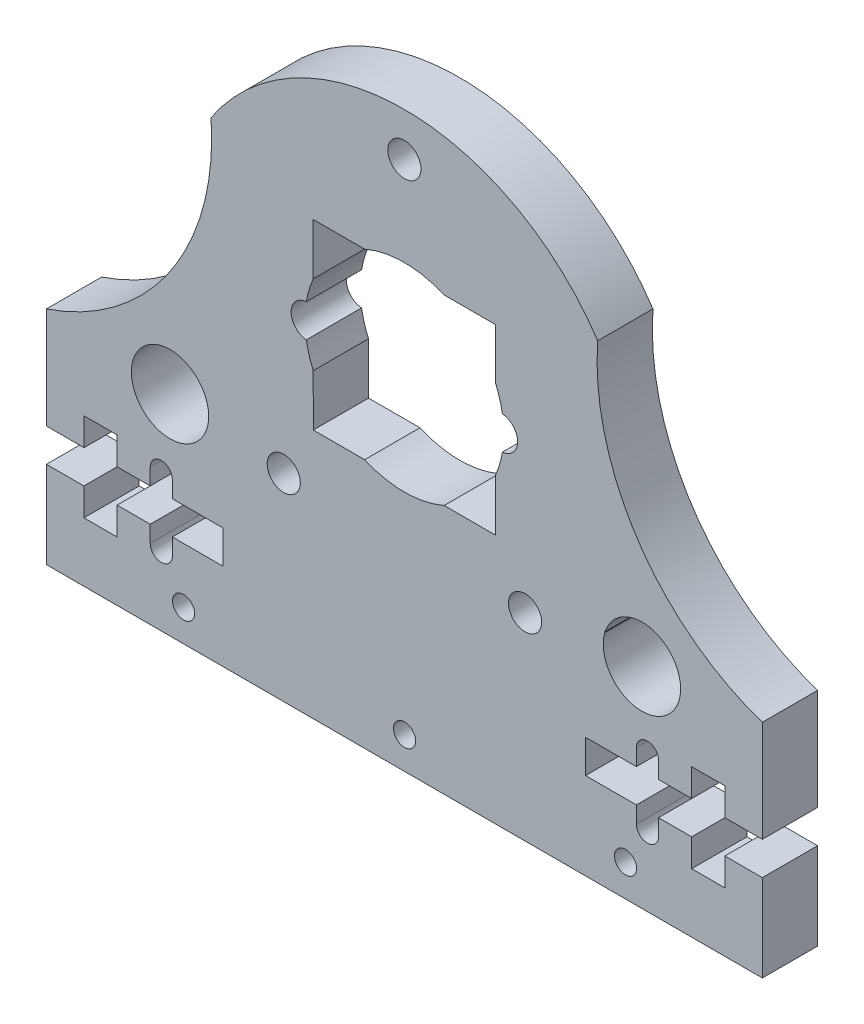
from build123d import *

# Parameters (mm, degrees)
SKETCH1_R           = 3.5
SKETCH1_R_2         = 1.5
BOSS_EXTRUDE1_DEPTH = 5
SKETCH2_W           = 3
SKETCH2_H           = 8
SKETCH2_W_2         = 16
SKETCH2_H_2         = 3
CUT_EXTRUDE3_DEPTH  = 10
SKETCH4_OUTSIDE_W   = 83.878
SKETCH4_OUTSIDE_H   = 74.539
CUT_EXTRUDE5_DEPTH  = 10
BOSS_EXTRUDE2_DEPTH = 5
SKETCH5_R           = 1
CUT_EXTRUDE6_DEPTH  = 5
CUT_EXTRUDE7_DEPTH  = 46.035343011


with BuildPart() as part:
    # Sketch1 → Boss-Extrude1 (new body)
    with BuildSketch(Plane.XY):
        with BuildLine():
            Line((16.678684739, -6.865443356), (7.048954955, 19.63254949))
            ThreePointArc((7.048954955, 19.63254949), (-0.000574134, 24.570863688), (-7.049347073, 19.631470247))
            Line((-7.049347073, 19.631470247), (-16.60248251, -6.668301445))
            ThreePointArc((-16.60248251, -6.668301445), (-23.589225287, -5.352701736), (-28.111762071, -10.838322782))
            Line((-28.111762071, -10.838322782), (-32.396038203, -10.838322782))
            Line((-32.396038203, -10.838322782), (-32.396038203, -30.881690835))
            Line((-32.396038203, -30.881690835), (32.396038203, -30.881690835))
            Line((32.396038203, -30.881690835), (32.396038203, -10.838322782))
            Line((32.396038203, -10.838322782), (28.403544795, -10.838322782))
            ThreePointArc((28.403544795, -10.838322782), (23.74315896, -5.304380506), (16.678684739, -6.865443356))
        make_face()
        with Locations((-21.209007359, -11.922115015)):
            Circle(SKETCH1_R, mode=Mode.SUBTRACT)
        with BuildLine():
            Line((3.592595297, 8.251863973), (8.245757774, 8.254276772))
            Line((8.245757774, 8.254276772), (8.248133809, 3.67201473))
            ThreePointArc((8.248133809, 3.67201473), (8.625435504, 2.640272663), (8.874223719, 1.570248043))
            ThreePointArc((8.874223719, 1.570248043), (10.249998622, 0.076178628), (8.875773895, -1.41931674))
            ThreePointArc((8.875773895, -1.41931674), (8.62809549, -2.489598792), (8.251863973, -3.521731588))
            Line((8.251863973, -3.521731588), (8.254313497, -8.24572101))
            Line((8.254313497, -8.24572101), (3.601151021, -8.248133809))
            ThreePointArc((3.601151021, -8.248133809), (0.004666758, -8.99999879), (-3.592595297, -8.251863973))
            Line((-3.592595297, -8.251863973), (-8.245721029, -8.254276752))
            Line((-8.245721029, -8.254276752), (-8.248133809, -3.601151021))
            ThreePointArc((-8.248133809, -3.601151021), (-8.625435504, -2.569408953), (-8.874223719, -1.499384334))
            ThreePointArc((-8.874223719, -1.499384334), (-10.249998622, -0.005314919), (-8.875773895, 1.49018045))
            ThreePointArc((-8.875773895, 1.49018045), (-8.62809549, 2.560462502), (-8.251863973, 3.592595297))
            Line((-8.251863973, 3.592595297), (-8.254276752, 8.245721029))
            Line((-8.254276752, 8.245721029), (-3.601151021, 8.248133809))
            ThreePointArc((-3.601151021, 8.248133809), (-0.004666758, 8.99999879), (3.592595297, 8.251863973))
        make_face(mode=Mode.SUBTRACT)
        with Locations((0, 17.070863709)):
            Circle(SKETCH1_R_2, mode=Mode.SUBTRACT)
        with BuildLine():
            ThreePointArc((18.172818569, -10.838322782), (24.845541744, -12.952957548), (18.140100673, -10.944481806))
            ThreePointArc((18.140100673, -10.944481806), (18.124834746, -10.891345307), (18.109177542, -10.838322782))
            Line((18.109177542, -10.838322782), (18.172818569, -10.838322782))
        make_face(mode=Mode.SUBTRACT)
        with Locations((10.924107384, -12.988849886)):
            Circle(SKETCH1_R_2, mode=Mode.SUBTRACT)
        with Locations((-10.919568848, -12.990697711)):
            Circle(SKETCH1_R_2, mode=Mode.SUBTRACT)
    extrude(amount=BOSS_EXTRUDE1_DEPTH)

    # Sketch2 → Cut-Extrude3 (cut)
    with BuildSketch(Plane.XY.offset(5)):
        with Locations((27.500296009, -21.513780425)):
            Rectangle(SKETCH2_W, SKETCH2_H)
        with Locations((24.396038203, -21.513780425)):
            Rectangle(SKETCH2_W_2, SKETCH2_H_2)
        with BuildLine():
            Line((23.000296009, -18.513780425), (23.000296009, -24.513780425))
            ThreePointArc((23.000296009, -24.513780425), (22.000296009, -25.513780425), (21.000296009, -24.513780425))
            Line((21.000296009, -24.513780425), (21.000296009, -18.513780425))
            ThreePointArc((21.000296009, -18.513780425), (22.000296009, -17.513780425), (23.000296009, -18.513780425))
        make_face()
    cut_extrude3 = extrude(amount=-CUT_EXTRUDE3_DEPTH, mode=Mode.SUBTRACT)

    # Mirror1: Cut-Extrude3 across plane
    add(cut_extrude3.mirror(Plane(origin=(0, 0, 0), x_dir=(0, 0, 1), z_dir=(1, 0, 0))), mode=Mode.SUBTRACT)

    # Sketch4 outside → Cut-Extrude5 (cut)
    with BuildSketch(Plane.XY.offset(5)):
        with Locations((0, -3.1555)):
            Rectangle(SKETCH4_OUTSIDE_W, SKETCH4_OUTSIDE_H)
        with BuildLine():
            Line((-28.111762071, -10.838322782), (-32.396038203, -10.838322782))
            Line((-32.396038203, -10.838322782), (-32.396038203, -30.881690835))
            Line((-32.396038203, -30.881690835), (32.396038203, -30.881690835))
            Line((32.396038203, -30.881690835), (32.396038203, -10.838322782))
            Line((32.396038203, -10.838322782), (28.403544795, -10.838322782))
            ThreePointArc((28.403544795, -10.838322782), (23.74315896, -5.304380506), (16.678684739, -6.865443356))
            Line((16.678684739, -6.865443356), (7.048954955, 19.63254949))
            Line((7.048954955, 19.63254949), (6.984017788, 19.804633184))
            ThreePointArc((6.984017788, 19.804633184), (0, 21), (-6.984017788, 19.804633184))
            Line((-6.984017788, 19.804633184), (-7.049347073, 19.631470247))
            Line((-7.049347073, 19.631470247), (-16.60248251, -6.668301445))
            ThreePointArc((-16.60248251, -6.668301445), (-23.589225287, -5.352701736), (-28.111762071, -10.838322782))
        make_face(mode=Mode.SUBTRACT)
    extrude(amount=-CUT_EXTRUDE5_DEPTH, mode=Mode.SUBTRACT)

    # Sketch4<5> → Boss-Extrude2 (add)
    with BuildSketch(Plane.XY.offset(5)):
        with BuildLine():
            Line((-17.497591027, 11.611817612), (-32.396038203, -10.838322782))
            Line((-32.396038203, -10.838322782), (-28.111762071, -10.838322782))
            ThreePointArc((-28.111762071, -10.838322782), (-23.589225287, -5.352701736), (-16.60248251, -6.668301445))
            Line((-16.60248251, -6.668301445), (-7.049347073, 19.631470247))
            Line((-7.049347073, 19.631470247), (-6.984017788, 19.804633184))
            ThreePointArc((-6.984017788, 19.804633184), (-12.90805366, 16.564484619), (-17.497591027, 11.611817612))
        make_face()
        with BuildLine():
            ThreePointArc((17.497591027, 11.611817612), (12.90805366, 16.564484619), (6.984017788, 19.804633184))
            Line((6.984017788, 19.804633184), (7.048954955, 19.63254949))
            Line((7.048954955, 19.63254949), (16.678684739, -6.865443356))
            ThreePointArc((16.678684739, -6.865443356), (23.74315896, -5.304380506), (28.403544795, -10.838322782))
            Line((28.403544795, -10.838322782), (32.396038203, -10.838322782))
            Line((32.396038203, -10.838322782), (17.497591027, 11.611817612))
        make_face()
    extrude(amount=-BOSS_EXTRUDE2_DEPTH)

    # Sketch5 → Cut-Extrude6 (cut)
    with BuildSketch(Plane.XY.offset(5)):
        with Locations((0.014555548, -27.999996217)):
            Circle(SKETCH5_R)
        with Locations((20.014552859, -27.989625643)):
            Circle(SKETCH5_R)
        with Locations((-19.985441764, -28.01036679)):
            Circle(SKETCH5_R)
    extrude(amount=-CUT_EXTRUDE6_DEPTH, mode=Mode.SUBTRACT)

    # Sketch6 → Cut-Extrude7 (cut, through all)
    with BuildSketch(Plane.XY.offset(5)):
        with BuildLine():
            ThreePointArc((-32.396038203, -10.838322782), (-21.107946915, -2.160816504), (-17.497591027, 11.611817612))
            ThreePointArc((-17.497591027, 11.611817612), (-30.842179781, 4.299051969), (-32.396038203, -10.838322782))
        make_face()
        with BuildLine():
            ThreePointArc((32.396038203, -10.838322782), (21.107946915, -2.160816504), (17.497591027, 11.611817612))
            ThreePointArc((17.497591027, 11.611817612), (30.860111099, 4.310951618), (32.396038203, -10.838322782))
        make_face()
    extrude(amount=-CUT_EXTRUDE7_DEPTH, mode=Mode.SUBTRACT)


solid = part.part
